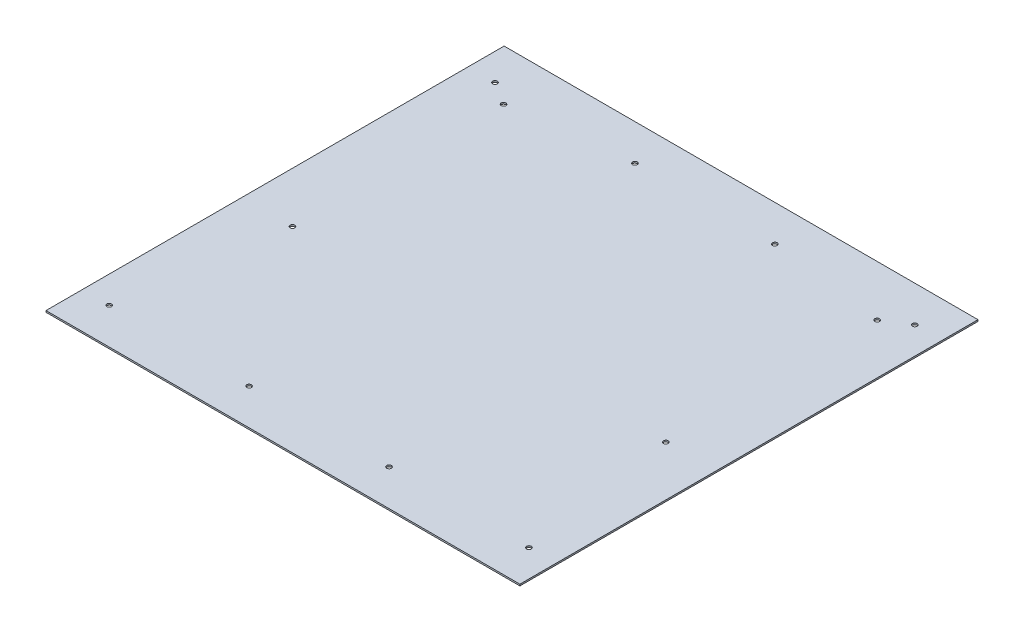
from build123d import *

# Parameters (mm, degrees)
SKETCH1_W          = 300
SKETCH1_H          = 290
BASE_FLANGE1_DEPTH = 1
SKETCH7_R          = 1.5
CUT_EXTRUDE1_DEPTH = 1
SKETCH9_R          = 1.5
CUT_EXTRUDE3_DEPTH = 418.254119213


# Sheet-metal steps are written as plain solids
with BuildPart() as part:
    # Sketch1 → Base-Flange1 (new body)
    with BuildSketch(Plane(origin=(0, 0, 0), x_dir=(1, 0, 0), z_dir=(0, 1, 0))):
        with Locations((150, -145)):
            Rectangle(SKETCH1_W, SKETCH1_H)
    extrude(amount=-BASE_FLANGE1_DEPTH)

    # Sketch7 → Cut-Extrude1 (cut)
    with BuildSketch(Plane.XZ.offset(1)):
        with Locations(Location((17.1317, 267.1317, 0), (0, 0, 270))):
            Circle(SKETCH7_R)
        with Locations(Location((105.710566667, 267.1317, 0), (0, 0, 270))):
            Circle(SKETCH7_R)
        with Locations(Location((194.289433333, 267.1317, 0), (0, 0, 270))):
            Circle(SKETCH7_R)
        with Locations(Location((282.8683, 267.1317, 0), (0, 0, 270))):
            Circle(SKETCH7_R)
        with Locations(Location((282.8683, 22.8683, 0), (0, 0, 270))):
            Circle(SKETCH7_R)
        with Locations(Location((194.289433333, 22.8683, 0), (0, 0, 270))):
            Circle(SKETCH7_R)
        with Locations(Location((105.710566667, 22.8683, 0), (0, 0, 270))):
            Circle(SKETCH7_R)
        with Locations(Location((17.1317, 22.8683, 0), (0, 0, 270))):
            Circle(SKETCH7_R)
    extrude(amount=-CUT_EXTRUDE1_DEPTH, mode=Mode.SUBTRACT)

    # Sketch9 → Cut-Extrude3 (cut, through all)
    with BuildSketch(Plane(origin=(0, 0, 0), x_dir=(1, 0, 0), z_dir=(0, 1, 0))):
        with Locations(Location((31.763, -32.132248658, 0), (0, 0, 270))):
            Circle(SKETCH9_R)
        with Locations(Location((31.941, -165.939248658, 0), (0, 0, 270))):
            Circle(SKETCH9_R)
        with Locations(Location((268.313, -165.939248658, 0), (0, 0, 270))):
            Circle(SKETCH9_R)
        with Locations(Location((268.313, -32.132248658, 0), (0, 0, 270))):
            Circle(SKETCH9_R)
    extrude(amount=-CUT_EXTRUDE3_DEPTH, mode=Mode.SUBTRACT)


solid = part.part
